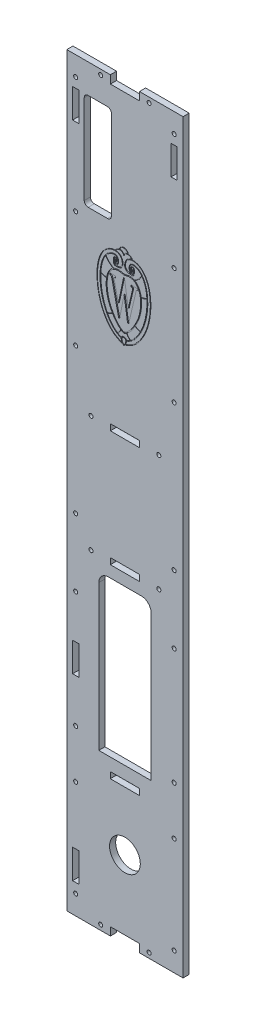
from build123d import *

# Parameters (mm, degrees)
SKETCH2_W               = 60
SKETCH2_H               = 385
BOSS_EXTRUDE1_DEPTH     = 3.175
CUT_EXTRUDE1_DEPTH      = 347.316445791
CUT_EXTRUDE1_DEPTH_BACK = 347.316445791
SKETCH4_R               = 7.9375
CUT_EXTRUDE2_DEPTH      = 347.316445791
CUT_EXTRUDE2_DEPTH_BACK = 347.316445791
SKETCH5_W               = 3.175
SKETCH5_H               = 15
SKETCH6_R               = 1.05
CUT_EXTRUDE3_DEPTH      = 3.175
SKETCH8_W               = 15
SKETCH8_H               = 4.175
CUT_EXTRUDE4_DEPTH      = 10
CUT_EXTRUDE5_DEPTH      = 10
SKETCH13_R              = 1.05
CUT_EXTRUDE8_DEPTH      = 347.316445791
SKETCH17_W              = 14
SKETCH17_H              = 50
CUT_EXTRUDE12_DEPTH     = 347.316445791
FILLET1_R               = 2
SKETCH18_R              = 1.05
CUT_EXTRUDE13_DEPTH     = 347.316445791
SKETCH19_R              = 1.05
CUT_EXTRUDE14_DEPTH     = 347.316445791
SKETCH20_W              = 15.1
SKETCH20_H              = 3.2
CUT_EXTRUDE15_DEPTH     = 347.316445791
CAVITY1_START           = -7.55
CAVITY1_OUTLINE_W       = 3.175
CAVITY1_OUTLINE_H       = 3.175
CAVITY1_DEPTH           = 15
SKETCH21_W              = 15.1
SKETCH21_H              = 3.2
CUT_EXTRUDE16_DEPTH     = 347.316445791
CAVITY2_START           = 2.675
CAVITY2_DEPTH           = 0.5


# Read off the part's stored shape, not the designer's step: Cavity1, Cavity2
with BuildPart() as part:
    # Sketch2 → Boss-Extrude1 (new body)
    with BuildSketch(Plane.XY):
        with Locations((0, 152.5)):
            Rectangle(SKETCH2_W, SKETCH2_H)
    extrude(amount=BOSS_EXTRUDE1_DEPTH)

    # Sketch4 → Cut-Extrude1 (cut, two sides: drawn at the far end of the back side and taken through both)
    with BuildSketch(Plane.XY.offset(3.175).offset(-CUT_EXTRUDE1_DEPTH_BACK)):
        Circle(SKETCH4_R)
    extrude(amount=CUT_EXTRUDE1_DEPTH + CUT_EXTRUDE1_DEPTH_BACK, mode=Mode.SUBTRACT)

    # Sketch5 → Cut-Extrude2 (cut, two sides: drawn at the far end of the back side and taken through both)
    with BuildSketch(Plane.XY.offset(3.175).offset(-CUT_EXTRUDE2_DEPTH_BACK)):
        with Locations((-25.4125, 322.5)):
            Rectangle(SKETCH5_W, SKETCH5_H)
        with Locations((-25.4125, 75)):
            Rectangle(SKETCH5_W, SKETCH5_H)
        with Locations((-25.4125, -17.5)):
            Rectangle(SKETCH5_W, SKETCH5_H)
        with Locations((25.4125, 322.5)):
            Rectangle(SKETCH5_W, SKETCH5_H)
    extrude(amount=CUT_EXTRUDE2_DEPTH + CUT_EXTRUDE2_DEPTH_BACK, mode=Mode.SUBTRACT)

    # Sketch6 → Cut-Extrude3 (cut)
    with BuildSketch(Plane.XY.offset(3.175)):
        with Locations((-25.4125, 335)):
            Circle(SKETCH6_R)
        with Locations((-25.4125, 105)):
            Circle(SKETCH6_R)
        with Locations((-25.4125, 45)):
            Circle(SKETCH6_R)
        with Locations((-25.4125, -30)):
            Circle(SKETCH6_R)
    cut_extrude3 = extrude(amount=-CUT_EXTRUDE3_DEPTH, mode=Mode.SUBTRACT)

    # Mirror2: Cut-Extrude3 across plane
    add(cut_extrude3.mirror(Plane(origin=(0, 0, 0), x_dir=(0, 0, 1), z_dir=(1, 0, 0))), mode=Mode.SUBTRACT)

    # Sketch8 → Cut-Extrude4 (cut)
    with BuildSketch(Plane.XY.offset(3.175)):
        with Locations((0, 342.9125)):
            Rectangle(SKETCH8_W, SKETCH8_H)
        with Locations((0, -37.9125)):
            Rectangle(SKETCH8_W, SKETCH8_H)
    extrude(amount=-CUT_EXTRUDE4_DEPTH, mode=Mode.SUBTRACT)

    # Sketch9 → Cut-Extrude5 (cut)
    with BuildSketch(Plane.XY.offset(3.175)):
        with BuildLine():
            Line((-13.5, 40), (13.5, 40))
            Line((13.5, 40), (13.5, 115))
            ThreePointArc((13.5, 115), (12.035533906, 118.535533906), (8.5, 120))
            Line((8.5, 120), (-8.5, 120))
            ThreePointArc((-8.5, 120), (-12.035533906, 118.535533906), (-13.5, 115))
            Line((-13.5, 115), (-13.5, 40))
        make_face()
    extrude(amount=-CUT_EXTRUDE5_DEPTH, mode=Mode.SUBTRACT)

    # Sketch13 → Cut-Extrude8 (cut, through all)
    with BuildSketch(Plane.XY.offset(3.175)):
        with Locations((-12.5, 342.4125)):
            Circle(SKETCH13_R)
        with Locations((-12.5, -37.4125)):
            Circle(SKETCH13_R)
    cut_extrude8 = extrude(amount=-CUT_EXTRUDE8_DEPTH, mode=Mode.SUBTRACT)

    # Mirror4: Cut-Extrude8 across plane
    add(cut_extrude8.mirror(Plane(origin=(0, 0, 0), x_dir=(0, 0, 1), z_dir=(1, 0, 0))), mode=Mode.SUBTRACT)

    # Sketch17 → Cut-Extrude12 (cut, through all)
    with BuildSketch(Plane.XY.offset(3.175)):
        with Locations((-14, 305)):
            Rectangle(SKETCH17_W, SKETCH17_H)
    extrude(amount=-CUT_EXTRUDE12_DEPTH, mode=Mode.SUBTRACT)

    # Fillet1
    fillet1_edges = [part.edges().sort_by_distance(p)[0] for p in [
        (-21, 280, 1.5875),
        (-21, 330, 1.5875),
        (-7, 330, 1.5875),
        (-7, 280, 1.5875),
    ]]
    fillet(fillet1_edges, radius=FILLET1_R)

    # Sketch18 → Cut-Extrude13 (cut, through all)
    with BuildSketch(Plane.XY.offset(3.175)):
        with Locations((-25.4, 275)):
            Circle(SKETCH18_R)
        with Locations((-25.4, 215)):
            Circle(SKETCH18_R)
        with Locations((-25.4, 140)):
            Circle(SKETCH18_R)
        with Locations((-25.4, 20)):
            Circle(SKETCH18_R)
    cut_extrude13 = extrude(amount=-CUT_EXTRUDE13_DEPTH, mode=Mode.SUBTRACT)

    # Mirror8: Cut-Extrude13 across plane
    add(cut_extrude13.mirror(Plane(origin=(0, 0, 0), x_dir=(0, 0, 1), z_dir=(1, 0, 0))), mode=Mode.SUBTRACT)

    # Sketch19 → Cut-Extrude14 (cut, through all)
    with BuildSketch(Plane.XY.offset(3.175)):
        with Locations((-17.5, 187.493166152)):
            Circle(SKETCH19_R)
        with Locations((-17.5, 127.493166152)):
            Circle(SKETCH19_R)
    cut_extrude14 = extrude(amount=-CUT_EXTRUDE14_DEPTH, mode=Mode.SUBTRACT)

    # Mirror9: Cut-Extrude14 across plane
    add(cut_extrude14.mirror(Plane(origin=(0, 0, 0), x_dir=(0, 0, 1), z_dir=(1, 0, 0))), mode=Mode.SUBTRACT)

    # Sketch20 → Cut-Extrude15 (cut, through all)
    with BuildSketch(Plane.XY.offset(3.175)):
        with Locations((0, 31.9)):
            Rectangle(SKETCH20_W, SKETCH20_H)
    extrude(amount=-CUT_EXTRUDE15_DEPTH, mode=Mode.SUBTRACT)

    # Cavity1 outline → Cavity1 (cut)
    with BuildSketch(Plane.YZ.offset(CAVITY1_START)):
        with Locations((127.5625, 1.5875)):
            Rectangle(CAVITY1_OUTLINE_W, CAVITY1_OUTLINE_H)
    extrude(amount=CAVITY1_DEPTH, mode=Mode.SUBTRACT)

    # Sketch21 → Cut-Extrude16 (cut, through all)
    with BuildSketch(Plane.XY.offset(3.175)):
        with Locations((0, 187.4)):
            Rectangle(SKETCH21_W, SKETCH21_H)
    extrude(amount=-CUT_EXTRUDE16_DEPTH, mode=Mode.SUBTRACT)

    # Cavity2 outline → Cavity2 (cut)
    # profile 1 of 2: a face of its own
    with BuildSketch(Plane.XY.offset(CAVITY2_START)):
        with BuildLine():
            Line((-1.094866392, 227.97508428), (-1.063616016, 227.928208715))
            add(Edge.make_bspline(
                [(-1.063616016, 227.928208715), (-0.85423849, 227.614142426), (-0.612048069, 227.362889396), (-0.52923457, 227.340389124)],
                knots=[0, 0, 0, 0, 1, 1, 1, 1], degree=3))
            add(Edge.make_bspline(
                [(-0.52923457, 227.340389124), (-0.446733575, 227.362576892), (-0.204855657, 227.614142426), (0.004521868, 227.928208715)],
                knots=[0, 0, 0, 0, 1, 1, 1, 1], degree=3))
            Line((0.004521868, 227.928208715), (0.035772245, 227.97508428))
            Line((0.035772245, 227.97508428), (0.091085412, 227.987896934))
            add(Edge.make_bspline(
                [(0.091085412, 227.987896934), (9.266820775, 230.126985236), (14.378132426, 244.212467006), (13.226556036, 255.516040534)],
                knots=[0, 0, 0, 0, 1, 1, 1, 1], degree=3))
            add(Edge.make_bspline(
                [(13.226556036, 255.516040534), (13.09342943, 256.821368778), (12.874989296, 258.050133599), (12.576235692, 259.188272327)],
                knots=[0, 0, 0, 0, 1, 1, 1, 1], degree=3))
            add(Edge.make_bspline(
                [(12.576235692, 259.188272327), (12.269669494, 260.352973876), (11.873727219, 261.441424504), (11.399033993, 262.423623851)],
                knots=[0, 0, 0, 0, 1, 1, 1, 1], degree=3))
            add(Edge.make_bspline(
                [(11.399033993, 262.423623851), (10.868715096, 263.520199578), (10.229332384, 264.482398684), (9.498073564, 265.283033341)],
                knots=[0, 0, 0, 0, 1, 1, 1, 1], degree=3))
            add(Edge.make_bspline(
                [(9.498073564, 265.283033341), (7.973992681, 266.953053484), (6.089907456, 267.851189005), (4.049258155, 267.880251855)],
                knots=[0, 0, 0, 0, 1, 1, 1, 1], degree=3))
            add(Edge.make_bspline(
                [(4.049258155, 267.880251855), (4.002695093, 267.881189367), (3.870193495, 267.884939412), (3.858630855, 268.007753393)],
                knots=[0, 0, 0, 0, 1, 1, 1, 1], degree=3))
            add(Edge.make_bspline(
                [(3.858630855, 268.007753393), (3.501439047, 268.735262168), (2.582365461, 269.243705801), (1.896107184, 269.33901945)],
                knots=[0, 0, 0, 0, 1, 1, 1, 1], degree=3))
            Line((1.896107184, 269.33901945), (1.80048103, 269.352457113))
            Line((1.80048103, 269.352457113), (1.777043248, 269.446520747))
            add(Edge.make_bspline(
                [(1.777043248, 269.446520747), (1.757980518, 269.523084171), (1.321100248, 271.245292443), (-0.531109593, 271.245292443)],
                knots=[0, 0, 0, 0, 1, 1, 1, 1], degree=3))
            add(Edge.make_bspline(
                [(-0.531109593, 271.245292443), (-2.388319494, 271.245292443), (-2.83488738, 269.473708575), (-2.839574937, 269.454958349)],
                knots=[0, 0, 0, 0, 1, 1, 1, 1], degree=3))
            Line((-2.839574937, 269.454958349), (-2.862387712, 269.360582211))
            Line((-2.862387712, 269.360582211), (-2.958638873, 269.347144548))
            add(Edge.make_bspline(
                [(-2.958638873, 269.347144548), (-3.645834662, 269.250893388), (-4.559595683, 268.736199679), (-4.91835001, 268.010565927)],
                knots=[0, 0, 0, 0, 1, 1, 1, 1], degree=3))
            add(Edge.make_bspline(
                [(-4.91835001, 268.010565927), (-4.928037627, 267.885251916), (-5.061476737, 267.881189367), (-5.106477279, 267.880251855)],
                knots=[0, 0, 0, 0, 1, 1, 1, 1], degree=3))
            add(Edge.make_bspline(
                [(-5.106477279, 267.880251855), (-7.149001603, 267.851189005), (-9.033399332, 266.953053484), (-10.557167712, 265.283033341)],
                knots=[0, 0, 0, 0, 1, 1, 1, 1], degree=3))
            add(Edge.make_bspline(
                [(-10.557167712, 265.283033341), (-11.395302821, 264.374584883), (-12.117811536, 263.232071103), (-12.70594363, 261.886429872)],
                knots=[0, 0, 0, 0, 1, 1, 1, 1], degree=3))
            Line((-12.70594363, 261.886429872), (-12.824382558, 261.606738998))
            add(Edge.make_bspline(
                [(-12.824382558, 261.606738998), (-13.562828965, 259.833905115), (-14.054709898, 257.784505396), (-14.285650184, 255.516040534)],
                knots=[0, 0, 0, 0, 1, 1, 1, 1], degree=3))
            add(Edge.make_bspline(
                [(-14.285650184, 255.516040534), (-15.436601566, 244.212154502), (-10.324977411, 230.126985236), (-1.15017956, 227.987896934)],
                knots=[0, 0, 0, 0, 1, 1, 1, 1], degree=3))
            Line((-1.15017956, 227.987896934), (-1.094866392, 227.97508428))
        make_face()
        with BuildLine():
            add(Edge.make_bspline(
                [(-0.529328321, 230.969838839), (-0.843394609, 230.966401298), (-1.389651198, 230.81983703), (-1.452464456, 230.495145614)],
                knots=[0, 0, 0, 0, 1, 1, 1, 1], degree=3))
            add(Edge.make_bspline(
                [(0.393807814, 230.495145614), (0.330682052, 230.81983703), (-0.215262033, 230.966401298), (-0.529328321, 230.969838839)],
                knots=[0, 0, 0, 0, 1, 1, 1, 1], degree=3))
            add(Edge.make_bspline(
                [(-0.371201414, 227.877301851), (0.025053366, 228.375432859), (0.616623001, 229.341694514), (0.393807814, 230.495145614)],
                knots=[0, 0, 0, 0, 1, 1, 1, 1], degree=3))
            add(Edge.make_bspline(
                [(-0.529328321, 227.771050569), (-0.451514883, 227.780113178), (-0.377451489, 227.870114264), (-0.371201414, 227.877301851)],
                knots=[0, 0, 0, 0, 1, 1, 1, 1], degree=3))
            add(Edge.make_bspline(
                [(-0.687455228, 227.877301851), (-0.681205153, 227.870114264), (-0.607454263, 227.780113178), (-0.529328321, 227.771050569)],
                knots=[0, 0, 0, 0, 1, 1, 1, 1], degree=3))
            add(Edge.make_bspline(
                [(-1.452464456, 230.495145614), (-1.675279643, 229.341694514), (-1.084022512, 228.375432859), (-0.687455228, 227.877301851)],
                knots=[0, 0, 0, 0, 1, 1, 1, 1], degree=3))
        make_face(mode=Mode.SUBTRACT)
        with BuildLine():
            add(Edge.make_bspline(
                [(0.801000225, 230.505145734), (1.429132801, 230.734836005), (2.03257758, 231.03952718), (2.61289708, 231.407031613)],
                knots=[0, 0, 0, 0, 1, 1, 1, 1], degree=3))
            add(Edge.make_bspline(
                [(0.791625112, 230.572021541), (0.795375157, 230.54952127), (0.79725018, 230.527333502), (0.801000225, 230.505145734)],
                knots=[0, 0, 0, 0, 1, 1, 1, 1], degree=3))
            add(Edge.make_bspline(
                [(-0.529328321, 231.377656258), (-0.210574476, 231.376718747), (0.661936048, 231.239842096), (0.791625112, 230.572021541)],
                knots=[0, 0, 0, 0, 1, 1, 1, 1], degree=3))
            add(Edge.make_bspline(
                [(-1.850594258, 230.572021541), (-1.720905194, 231.239842096), (-0.84839467, 231.376718747), (-0.529328321, 231.377656258)],
                knots=[0, 0, 0, 0, 1, 1, 1, 1], degree=3))
            add(Edge.make_bspline(
                [(-1.859969371, 230.505145734), (-1.855906822, 230.527333502), (-1.854344303, 230.54952127), (-1.850594258, 230.572021541)],
                knots=[0, 0, 0, 0, 1, 1, 1, 1], degree=3))
            add(Edge.make_bspline(
                [(-3.671553722, 231.407031613), (-3.091546726, 231.03952718), (-2.488101947, 230.734836005), (-1.859969371, 230.505145734)],
                knots=[0, 0, 0, 0, 1, 1, 1, 1], degree=3))
            add(Edge.make_bspline(
                [(-1.882782146, 233.605808134), (-2.326224995, 232.553607942), (-3.250923648, 231.738910616), (-3.671553722, 231.407031613)],
                knots=[0, 0, 0, 0, 1, 1, 1, 1], degree=3))
            add(Edge.make_bspline(
                [(-0.529328321, 232.860799148), (-0.613079331, 232.887674472), (-1.25464957, 233.147990112), (-1.882782146, 233.605808134)],
                knots=[0, 0, 0, 0, 1, 1, 1, 1], degree=3))
            add(Edge.make_bspline(
                [(0.824125504, 233.605808134), (0.195680424, 233.147990112), (-0.445889815, 232.887674472), (-0.529328321, 232.860799148)],
                knots=[0, 0, 0, 0, 1, 1, 1, 1], degree=3))
            add(Edge.make_bspline(
                [(2.61289708, 231.407031613), (2.191954502, 231.738910616), (1.267255849, 232.553607942), (0.824125504, 233.605808134)],
                knots=[0, 0, 0, 0, 1, 1, 1, 1], degree=3))
        make_face(mode=Mode.SUBTRACT)
        with BuildLine():
            add(Edge.make_bspline(
                [(-9.008492782, 237.706170091), (-7.657226483, 235.093951083), (-5.939393576, 232.929862481), (-3.90936909, 231.56515852)],
                knots=[0, 0, 0, 0, 1, 1, 1, 1], degree=3))
            add(Edge.make_bspline(
                [(-6.395024072, 238.900872001), (-7.268784298, 238.131175217), (-8.488799014, 237.812733876), (-9.008492782, 237.706170091)],
                knots=[0, 0, 0, 0, 1, 1, 1, 1], degree=3))
            add(Edge.make_bspline(
                [(-2.118097484, 233.769872613), (-3.295299183, 234.615507812), (-4.838442796, 236.216777126), (-6.395024072, 238.900872001)],
                knots=[0, 0, 0, 0, 1, 1, 1, 1], degree=3))
            add(Edge.make_bspline(
                [(-3.90936909, 231.56515852), (-3.554364808, 231.839536829), (-2.544352626, 232.688609571), (-2.118097484, 233.769872613)],
                knots=[0, 0, 0, 0, 1, 1, 1, 1], degree=3))
        make_face(mode=Mode.SUBTRACT)
        with BuildLine():
            add(Edge.make_bspline(
                [(-12.412596341, 254.066679615), (-12.677599538, 248.64005166), (-11.483522635, 242.620604368), (-9.137869342, 237.95648561)],
                knots=[0, 0, 0, 0, 1, 1, 1, 1], degree=3))
            add(Edge.make_bspline(
                [(-9.501936234, 253.252294792), (-10.833827299, 253.369483705), (-11.861339692, 253.789176267), (-12.412596341, 254.066679615)],
                knots=[0, 0, 0, 0, 1, 1, 1, 1], degree=3))
            add(Edge.make_bspline(
                [(-9.662875675, 251.577899596), (-9.64756299, 251.94884157), (-9.605999989, 252.54416125), (-9.501936234, 253.252294792)],
                knots=[0, 0, 0, 0, 1, 1, 1, 1], degree=3))
            add(Edge.make_bspline(
                [(-9.466935812, 247.566601212), (-9.651938043, 248.896617255), (-9.718188842, 250.243508501), (-9.662875675, 251.577899596)],
                knots=[0, 0, 0, 0, 1, 1, 1, 1], degree=3))
            add(Edge.make_bspline(
                [(-8.62692568, 243.859681501), (-9.010992812, 245.064071028), (-9.291933701, 246.30783603), (-9.466935812, 247.566601212)],
                knots=[0, 0, 0, 0, 1, 1, 1, 1], degree=3))
            add(Edge.make_bspline(
                [(-6.534088249, 239.1411874), (-7.383160678, 240.640580485), (-8.102856858, 242.216849498), (-8.62692568, 243.859681501)],
                knots=[0, 0, 0, 0, 1, 1, 1, 1], degree=3))
            add(Edge.make_bspline(
                [(-9.137869342, 237.95648561), (-8.700051562, 238.042424147), (-7.400660889, 238.353052894), (-6.534088249, 239.1411874)],
                knots=[0, 0, 0, 0, 1, 1, 1, 1], degree=3))
        make_face(mode=Mode.SUBTRACT)
        with BuildLine():
            add(Edge.make_bspline(
                [(-13.703861916, 257.600159422), (-13.880426546, 256.634210271), (-13.997615459, 255.658573503), (-14.078553936, 254.680437018)],
                knots=[0, 0, 0, 0, 1, 1, 1, 1], degree=3))
            add(Edge.make_bspline(
                [(-12.981040698, 260.438318655), (-13.296044497, 259.513620002), (-13.528547302, 258.560483505), (-13.703861916, 257.600159422)],
                knots=[0, 0, 0, 0, 1, 1, 1, 1], degree=3))
            add(Edge.make_bspline(
                [(-11.916965363, 262.900848357), (-12.346033038, 262.113963866), (-12.692599719, 261.286141381), (-12.981040698, 260.438318655)],
                knots=[0, 0, 0, 0, 1, 1, 1, 1], degree=3))
            add(Edge.make_bspline(
                [(-10.32319614, 265.14618794), (-10.95664128, 264.481179919), (-11.478522575, 263.705545564), (-11.916965363, 262.900848357)],
                knots=[0, 0, 0, 0, 1, 1, 1, 1], degree=3))
            add(Edge.make_bspline(
                [(-8.315984429, 266.717456892), (-9.069743521, 266.306826939), (-9.732876519, 265.766507922), (-10.32319614, 265.14618794)],
                knots=[0, 0, 0, 0, 1, 1, 1, 1], degree=3))
            add(Edge.make_bspline(
                [(-7.338160135, 267.158087207), (-7.674726694, 267.036523241), (-8.001605637, 266.888708958), (-8.315984429, 266.717456892)],
                knots=[0, 0, 0, 0, 1, 1, 1, 1], degree=3))
            add(Edge.make_bspline(
                [(-6.818154175, 267.322151686), (-6.993781294, 267.274651113), (-7.167220573, 267.21965045), (-7.338160135, 267.158087207)],
                knots=[0, 0, 0, 0, 1, 1, 1, 1], degree=3))
            add(Edge.make_bspline(
                [(-6.295647873, 267.452778262), (-6.468462457, 267.428715471), (-6.658777253, 267.36558971), (-6.818154175, 267.322151686)],
                knots=[0, 0, 0, 0, 1, 1, 1, 1], degree=3))
            add(Edge.make_bspline(
                [(-4.999694741, 267.559029543), (-5.434074981, 267.559029543), (-5.86845522, 267.532154219), (-6.295647873, 267.452778262)],
                knots=[0, 0, 0, 0, 1, 1, 1, 1], degree=3))
            add(Edge.make_bspline(
                [(-3.033733529, 267.02902315), (-3.788117628, 267.503091369), (-4.645627971, 267.559029543), (-4.999694741, 267.559029543)],
                knots=[0, 0, 0, 0, 1, 1, 1, 1], degree=3))
            add(Edge.make_bspline(
                [(-1.345275663, 263.968361234), (-1.47433972, 265.458066702), (-2.202473502, 266.438078523), (-3.033733529, 267.02902315)],
                knots=[0, 0, 0, 0, 1, 1, 1, 1], degree=3))
            add(Edge.make_bspline(
                [(-3.932494369, 261.325204353), (-3.475613858, 261.321141804), (-1.14527325, 261.682083657), (-1.345275663, 263.968361234)],
                knots=[0, 0, 0, 0, 1, 1, 1, 1], degree=3))
            add(Edge.make_bspline(
                [(-3.812492922, 261.626145482), (-4.039058155, 261.391767655), (-4.002495214, 261.326141864), (-3.932494369, 261.325204353)],
                knots=[0, 0, 0, 0, 1, 1, 1, 1], degree=3))
            add(Edge.make_bspline(
                [(-3.281549018, 264.209614143), (-3.102171854, 263.365228959), (-3.276861461, 262.313341271), (-3.812492922, 261.626145482)],
                knots=[0, 0, 0, 0, 1, 1, 1, 1], degree=3))
            add(Edge.make_bspline(
                [(-5.316573564, 266.076824165), (-4.242810612, 266.078699188), (-3.502489183, 265.259001801), (-3.281549018, 264.209614143)],
                knots=[0, 0, 0, 0, 1, 1, 1, 1], degree=3))
            add(Edge.make_bspline(
                [(-9.425997818, 264.105237885), (-8.358484942, 265.268689418), (-6.923467945, 266.074011631), (-5.316573564, 266.076824165)],
                knots=[0, 0, 0, 0, 1, 1, 1, 1], degree=3))
            add(Edge.make_bspline(
                [(-11.687587596, 260.122377344), (-11.178518956, 261.56208221), (-10.464760347, 262.972724224), (-9.425997818, 264.105237885)],
                knots=[0, 0, 0, 0, 1, 1, 1, 1], degree=3))
            add(Edge.make_bspline(
                [(-12.801976038, 254.362933188), (-12.670411951, 256.31826896), (-12.342282993, 258.270792511), (-11.687587596, 260.122377344)],
                knots=[0, 0, 0, 0, 1, 1, 1, 1], degree=3))
            add(Edge.make_bspline(
                [(-12.68603714, 248.975680708), (-12.871976882, 250.763202269), (-12.922602493, 252.568849048), (-12.801976038, 254.362933188)],
                knots=[0, 0, 0, 0, 1, 1, 1, 1], degree=3))
            add(Edge.make_bspline(
                [(-11.699150236, 243.611866012), (-12.168218394, 245.370012218), (-12.49790987, 247.16597138), (-12.68603714, 248.975680708)],
                knots=[0, 0, 0, 0, 1, 1, 1, 1], degree=3))
            add(Edge.make_bspline(
                [(-9.913503698, 238.62305615), (-10.656012654, 240.22807551), (-11.24351974, 241.903720721), (-11.699150236, 243.611866012)],
                knots=[0, 0, 0, 0, 1, 1, 1, 1], degree=3))
            add(Edge.make_bspline(
                [(-7.139095234, 234.055501058), (-8.260046254, 235.447080343), (-9.167869704, 237.010536701), (-9.913503698, 238.62305615)],
                knots=[0, 0, 0, 0, 1, 1, 1, 1], degree=3))
            add(Edge.make_bspline(
                [(-3.020920874, 230.575771586), (-4.624377714, 231.398594011), (-6.013769473, 232.658296705), (-7.139095234, 234.055501058)],
                knots=[0, 0, 0, 0, 1, 1, 1, 1], degree=3))
            add(Edge.make_bspline(
                [(-1.903094891, 230.090766049), (-2.286224512, 230.227017692), (-2.659354013, 230.390144347), (-3.020920874, 230.575771586)],
                knots=[0, 0, 0, 0, 1, 1, 1, 1], degree=3))
            add(Edge.make_bspline(
                [(-1.566528332, 228.520747112), (-1.772780819, 228.961377426), (-1.925282659, 229.493571346), (-1.903094891, 230.090766049)],
                knots=[0, 0, 0, 0, 1, 1, 1, 1], degree=3))
            add(Edge.make_bspline(
                [(-2.039346535, 228.660123793), (-1.826531468, 228.590122948), (-1.820281392, 228.577622798), (-1.566528332, 228.520747112)],
                knots=[0, 0, 0, 0, 1, 1, 1, 1], degree=3))
            add(Edge.make_bspline(
                [(-5.01031987, 230.143579186), (-4.092183795, 229.513259083), (-3.090296711, 229.006690473), (-2.039346535, 228.660123793)],
                knots=[0, 0, 0, 0, 1, 1, 1, 1], degree=3))
            add(Edge.make_bspline(
                [(-6.653777193, 231.469219863), (-6.143458537, 230.990464088), (-5.593451903, 230.543583698), (-5.01031987, 230.143579186)],
                knots=[0, 0, 0, 0, 1, 1, 1, 1], degree=3))
            add(Edge.make_bspline(
                [(-7.844728745, 232.718922436), (-7.470661733, 232.281417159), (-7.073469442, 231.863287116), (-6.653777193, 231.469219863)],
                knots=[0, 0, 0, 0, 1, 1, 1, 1], degree=3))
            add(Edge.make_bspline(
                [(-8.581925137, 233.636433503), (-8.34504728, 233.32361723), (-8.099731821, 233.017051032), (-7.844728745, 232.718922436)],
                knots=[0, 0, 0, 0, 1, 1, 1, 1], degree=3))
            add(Edge.make_bspline(
                [(-11.404146678, 238.539930148), (-10.65320012, 236.815534349), (-9.718188842, 235.137389107), (-8.581925137, 233.636433503)],
                knots=[0, 0, 0, 0, 1, 1, 1, 1], degree=3))
            add(Edge.make_bspline(
                [(-13.13791759, 243.702804608), (-12.702287336, 241.938721143), (-12.12978043, 240.206200246), (-11.404146678, 238.539930148)],
                knots=[0, 0, 0, 0, 1, 1, 1, 1], degree=3))
            add(Edge.make_bspline(
                [(-14.044178521, 249.194120843), (-13.885114102, 247.344098529), (-13.582922958, 245.505638854), (-13.13791759, 243.702804608)],
                knots=[0, 0, 0, 0, 1, 1, 1, 1], degree=3))
            add(Edge.make_bspline(
                [(-14.078553936, 254.680437018), (-14.22980576, 252.858227539), (-14.200742909, 251.014767803), (-14.044178521, 249.194120843)],
                knots=[0, 0, 0, 0, 1, 1, 1, 1], degree=3))
        make_face(mode=Mode.SUBTRACT)
        with BuildLine():
            add(Edge.make_bspline(
                [(-0.717111836, 233.504869416), (-3.048389955, 234.540506908), (-5.410918452, 237.58585614), (-7.366566728, 241.8937206)],
                knots=[0, 0, 0, 0, 1, 1, 1, 1], degree=3))
            add(Edge.make_bspline(
                [(-7.366566728, 241.8937206), (-7.838759923, 242.931232802), (-9.360965783, 246.691278155), (-9.159088348, 251.505398721)],
                knots=[0, 0, 0, 0, 1, 1, 1, 1], degree=3))
            add(Edge.make_bspline(
                [(-9.159088348, 251.505398721), (-9.101900159, 252.866352637), (-8.704395364, 257.021402441), (-5.876861572, 258.824236687)],
                knots=[0, 0, 0, 0, 1, 1, 1, 1], degree=3))
            add(Edge.make_bspline(
                [(-5.876861572, 258.824236687), (-5.265604199, 259.212991376), (-4.463094519, 259.384555945), (-3.65652229, 259.437056578)],
                knots=[0, 0, 0, 0, 1, 1, 1, 1], degree=3))
            add(Edge.make_bspline(
                [(-3.65652229, 259.437056578), (-2.268380547, 259.527370168), (-1.239618138, 258.996738767), (-0.546797282, 258.977363533)],
                knots=[0, 0, 0, 0, 1, 1, 1, 1], degree=3))
            Line((-0.546797282, 258.977363533), (-0.512109363, 258.977363533))
            add(Edge.make_bspline(
                [(-0.512109363, 258.977363533), (0.180711493, 258.996738767), (1.217599, 259.527370168), (2.605740743, 259.437056578)],
                knots=[0, 0, 0, 0, 1, 1, 1, 1], degree=3))
            add(Edge.make_bspline(
                [(2.605740743, 259.437056578), (3.411687964, 259.384555945), (4.206697554, 259.212991376), (4.817954926, 258.824236687)],
                knots=[0, 0, 0, 0, 1, 1, 1, 1], degree=3))
            add(Edge.make_bspline(
                [(4.817954926, 258.824236687), (7.644863711, 257.021402441), (8.042993513, 252.866352637), (8.100181703, 251.505398721)],
                knots=[0, 0, 0, 0, 1, 1, 1, 1], degree=3))
            add(Edge.make_bspline(
                [(8.100181703, 251.505398721), (8.302059138, 246.691278155), (6.780165782, 242.931232802), (6.30828509, 241.8937206)],
                knots=[0, 0, 0, 0, 1, 1, 1, 1], degree=3))
            add(Edge.make_bspline(
                [(6.30828509, 241.8937206), (4.351386799, 237.58585614), (1.989795814, 234.540506908), (-0.34273232, 233.504869416)],
                knots=[0, 0, 0, 0, 1, 1, 1, 1], degree=3))
            Line((-0.34273232, 233.504869416), (-0.528984567, 233.42143091))
            Line((-0.528984567, 233.42143091), (-0.717111836, 233.504869416))
        make_face(mode=Mode.SUBTRACT)
        with BuildLine():
            add(Edge.make_bspline(
                [(2.850399944, 231.56515852), (4.88042443, 232.929862481), (6.598257337, 235.093951083), (7.949523636, 237.706170091)],
                knots=[0, 0, 0, 0, 1, 1, 1, 1], degree=3))
            add(Edge.make_bspline(
                [(1.059128338, 233.769872613), (1.485695984, 232.688609571), (2.495708166, 231.839536829), (2.850399944, 231.56515852)],
                knots=[0, 0, 0, 0, 1, 1, 1, 1], degree=3))
            add(Edge.make_bspline(
                [(5.336367429, 238.900872001), (3.77947365, 236.216777126), (2.236330038, 234.615507812), (1.059128338, 233.769872613)],
                knots=[0, 0, 0, 0, 1, 1, 1, 1], degree=3))
            add(Edge.make_bspline(
                [(7.949523636, 237.706170091), (7.429829868, 237.812733876), (6.209815152, 238.131175217), (5.336367429, 238.900872001)],
                knots=[0, 0, 0, 0, 1, 1, 1, 1], degree=3))
        make_face(mode=Mode.SUBTRACT)
        with BuildLine():
            add(Edge.make_bspline(
                [(0.844438249, 230.090766049), (0.866626017, 229.493571346), (0.713811673, 228.961377426), (0.507559186, 228.520747112)],
                knots=[0, 0, 0, 0, 1, 1, 1, 1], degree=3))
            add(Edge.make_bspline(
                [(1.961951728, 230.575771586), (1.600384867, 230.390144347), (1.227255366, 230.227017692), (0.844438249, 230.090766049)],
                knots=[0, 0, 0, 0, 1, 1, 1, 1], degree=3))
            add(Edge.make_bspline(
                [(6.080126088, 234.055501058), (4.954800327, 232.658296705), (3.565721072, 231.398594011), (1.961951728, 230.575771586)],
                knots=[0, 0, 0, 0, 1, 1, 1, 1], degree=3))
            add(Edge.make_bspline(
                [(8.854847056, 238.62305615), (8.109213062, 237.010536701), (7.201077108, 235.447080343), (6.080126088, 234.055501058)],
                knots=[0, 0, 0, 0, 1, 1, 1, 1], degree=3))
            add(Edge.make_bspline(
                [(10.640493594, 243.611866012), (10.184863098, 241.903720721), (9.597043508, 240.22807551), (8.854847056, 238.62305615)],
                knots=[0, 0, 0, 0, 1, 1, 1, 1], degree=3))
            add(Edge.make_bspline(
                [(11.627380497, 248.975680708), (11.438940724, 247.16597138), (11.109561752, 245.370012218), (10.640493594, 243.611866012)],
                knots=[0, 0, 0, 0, 1, 1, 1, 1], degree=3))
            add(Edge.make_bspline(
                [(11.743006892, 254.362933188), (11.863945851, 252.568849048), (11.81332024, 250.763202269), (11.627380497, 248.975680708)],
                knots=[0, 0, 0, 0, 1, 1, 1, 1], degree=3))
            add(Edge.make_bspline(
                [(10.628618451, 260.122377344), (11.283313847, 258.270792511), (11.611442805, 256.31826896), (11.743006892, 254.362933188)],
                knots=[0, 0, 0, 0, 1, 1, 1, 1], degree=3))
            add(Edge.make_bspline(
                [(8.367028672, 264.105237885), (9.405791201, 262.972724224), (10.11954981, 261.56208221), (10.628618451, 260.122377344)],
                knots=[0, 0, 0, 0, 1, 1, 1, 1], degree=3))
            add(Edge.make_bspline(
                [(4.257916921, 266.076824165), (5.864498487, 266.074011631), (7.299515796, 265.268689418), (8.367028672, 264.105237885)],
                knots=[0, 0, 0, 0, 1, 1, 1, 1], degree=3))
            add(Edge.make_bspline(
                [(2.222892375, 264.209614143), (2.44383254, 265.259001801), (3.18415397, 266.078699188), (4.257916921, 266.076824165)],
                knots=[0, 0, 0, 0, 1, 1, 1, 1], degree=3))
            add(Edge.make_bspline(
                [(2.753523776, 261.626145482), (2.217892315, 262.313341271), (2.043202708, 263.365228959), (2.222892375, 264.209614143)],
                knots=[0, 0, 0, 0, 1, 1, 1, 1], degree=3))
            add(Edge.make_bspline(
                [(2.873525223, 261.325204353), (2.943526068, 261.326141864), (2.980089009, 261.391767655), (2.753523776, 261.626145482)],
                knots=[0, 0, 0, 0, 1, 1, 1, 1], degree=3))
            add(Edge.make_bspline(
                [(0.286306517, 263.968361234), (0.086616608, 261.682083657), (2.416957216, 261.321141804), (2.873525223, 261.325204353)],
                knots=[0, 0, 0, 0, 1, 1, 1, 1], degree=3))
            add(Edge.make_bspline(
                [(1.975076886, 267.02902315), (1.143504356, 266.438078523), (0.415683077, 265.458066702), (0.286306517, 263.968361234)],
                knots=[0, 0, 0, 0, 1, 1, 1, 1], degree=3))
            add(Edge.make_bspline(
                [(3.940725595, 267.559029543), (3.586971329, 267.559029543), (2.729148482, 267.503091369), (1.975076886, 267.02902315)],
                knots=[0, 0, 0, 0, 1, 1, 1, 1], degree=3))
            add(Edge.make_bspline(
                [(5.236991231, 267.452778262), (4.809798578, 267.532154219), (4.375105835, 267.559029543), (3.940725595, 267.559029543)],
                knots=[0, 0, 0, 0, 1, 1, 1, 1], degree=3))
            add(Edge.make_bspline(
                [(5.75949722, 267.322151686), (5.599807794, 267.36558971), (5.399493191, 267.431215502), (5.236991231, 267.452778262)],
                knots=[0, 0, 0, 0, 1, 1, 1, 1], degree=3))
            add(Edge.make_bspline(
                [(6.279190989, 267.158087207), (6.108251427, 267.21965045), (5.934811835, 267.274651113), (5.75949722, 267.322151686)],
                knots=[0, 0, 0, 0, 1, 1, 1, 1], degree=3))
            add(Edge.make_bspline(
                [(7.257015283, 266.717456892), (6.942948995, 266.888708958), (6.616070052, 267.036523241), (6.279190989, 267.158087207)],
                knots=[0, 0, 0, 0, 1, 1, 1, 1], degree=3))
            add(Edge.make_bspline(
                [(9.264539497, 265.14618794), (8.673907373, 265.766507922), (8.011086879, 266.306826939), (7.257015283, 266.717456892)],
                knots=[0, 0, 0, 0, 1, 1, 1, 1], degree=3))
            add(Edge.make_bspline(
                [(10.857996217, 262.900848357), (10.419553429, 263.705545564), (9.897672134, 264.481179919), (9.264539497, 265.14618794)],
                knots=[0, 0, 0, 0, 1, 1, 1, 1], degree=3))
            add(Edge.make_bspline(
                [(11.922384056, 260.438318655), (11.633630573, 261.286141381), (11.287063893, 262.113963866), (10.857996217, 262.900848357)],
                knots=[0, 0, 0, 0, 1, 1, 1, 1], degree=3))
            add(Edge.make_bspline(
                [(12.645205274, 257.600159422), (12.469578156, 258.560483505), (12.237075351, 259.513620002), (11.922384056, 260.438318655)],
                knots=[0, 0, 0, 0, 1, 1, 1, 1], degree=3))
            add(Edge.make_bspline(
                [(13.019897293, 254.680437018), (12.938958817, 255.658573503), (12.8214574, 256.634210271), (12.645205274, 257.600159422)],
                knots=[0, 0, 0, 0, 1, 1, 1, 1], degree=3))
            add(Edge.make_bspline(
                [(12.985209375, 249.194120843), (13.141773764, 251.014767803), (13.170836614, 252.858227539), (13.019897293, 254.680437018)],
                knots=[0, 0, 0, 0, 1, 1, 1, 1], degree=3))
            add(Edge.make_bspline(
                [(12.078948444, 243.702804608), (12.523953812, 245.505638854), (12.82645746, 247.344098529), (12.985209375, 249.194120843)],
                knots=[0, 0, 0, 0, 1, 1, 1, 1], degree=3))
            add(Edge.make_bspline(
                [(10.345490035, 238.539930148), (11.071123788, 240.206200246), (11.643630693, 241.938721143), (12.078948444, 243.702804608)],
                knots=[0, 0, 0, 0, 1, 1, 1, 1], degree=3))
            add(Edge.make_bspline(
                [(7.522955991, 233.636433503), (8.659219696, 235.137389107), (9.594543478, 236.815534349), (10.345490035, 238.539930148)],
                knots=[0, 0, 0, 0, 1, 1, 1, 1], degree=3))
            add(Edge.make_bspline(
                [(6.785759599, 232.718922436), (7.040762675, 233.017051032), (7.286078134, 233.32361723), (7.522955991, 233.636433503)],
                knots=[0, 0, 0, 0, 1, 1, 1, 1], degree=3))
            add(Edge.make_bspline(
                [(5.594807734, 231.469219863), (6.0148128, 231.863287116), (6.411692587, 232.281417159), (6.785759599, 232.718922436)],
                knots=[0, 0, 0, 0, 1, 1, 1, 1], degree=3))
            add(Edge.make_bspline(
                [(3.951350724, 230.143579186), (4.534482757, 230.543583698), (5.084801895, 230.990464088), (5.594807734, 231.469219863)],
                knots=[0, 0, 0, 0, 1, 1, 1, 1], degree=3))
            add(Edge.make_bspline(
                [(0.980377389, 228.660123793), (2.031327565, 229.006690473), (3.033527153, 229.513259083), (3.951350724, 230.143579186)],
                knots=[0, 0, 0, 0, 1, 1, 1, 1], degree=3))
            add(Edge.make_bspline(
                [(0.507559186, 228.520747112), (0.761312246, 228.577622798), (0.767562322, 228.590122948), (0.980377389, 228.660123793)],
                knots=[0, 0, 0, 0, 1, 1, 1, 1], degree=3))
        make_face(mode=Mode.SUBTRACT)
        with BuildLine():
            add(Edge.make_bspline(
                [(8.0792127, 237.95648561), (10.424553489, 242.620604368), (11.618630392, 248.64005166), (11.353939699, 254.066679615)],
                knots=[0, 0, 0, 0, 1, 1, 1, 1], degree=3))
            add(Edge.make_bspline(
                [(5.47511879, 239.1411874), (6.342004247, 238.353052894), (7.641082416, 238.042424147), (8.0792127, 237.95648561)],
                knots=[0, 0, 0, 0, 1, 1, 1, 1], degree=3))
            add(Edge.make_bspline(
                [(7.567956534, 243.859681501), (7.043887712, 242.216849498), (6.324504035, 240.640580485), (5.47511879, 239.1411874)],
                knots=[0, 0, 0, 0, 1, 1, 1, 1], degree=3))
            add(Edge.make_bspline(
                [(8.408279169, 247.566601212), (8.233277059, 246.30783603), (7.95233617, 245.064071028), (7.567956534, 243.859681501)],
                knots=[0, 0, 0, 0, 1, 1, 1, 1], degree=3))
            add(Edge.make_bspline(
                [(8.604219033, 251.577899596), (8.6595322, 250.243508501), (8.592968897, 248.896617255), (8.408279169, 247.566601212)],
                knots=[0, 0, 0, 0, 1, 1, 1, 1], degree=3))
            add(Edge.make_bspline(
                [(8.442967088, 253.252294792), (8.547030843, 252.54416125), (8.588906348, 251.94884157), (8.604219033, 251.577899596)],
                knots=[0, 0, 0, 0, 1, 1, 1, 1], degree=3))
            add(Edge.make_bspline(
                [(11.353939699, 254.066679615), (10.80268305, 253.789176267), (9.774858153, 253.369483705), (8.442967088, 253.252294792)],
                knots=[0, 0, 0, 0, 1, 1, 1, 1], degree=3))
        make_face(mode=Mode.SUBTRACT)
        with BuildLine():
            add(Edge.make_bspline(
                [(-9.872878208, 262.907098433), (-11.235394642, 260.971762589), (-12.175718484, 258.06672755), (-12.396033642, 254.364495707)],
                knots=[0, 0, 0, 0, 1, 1, 1, 1], degree=3))
            add(Edge.make_bspline(
                [(-6.130020875, 259.272367092), (-8.571925016, 260.705821882), (-9.631000291, 262.278340849), (-9.872878208, 262.907098433)],
                knots=[0, 0, 0, 0, 1, 1, 1, 1], degree=3))
            add(Edge.make_bspline(
                [(-9.459435721, 253.520423026), (-9.144431922, 255.443258406), (-8.191607929, 257.97391393), (-6.130020875, 259.272367092)],
                knots=[0, 0, 0, 0, 1, 1, 1, 1], degree=3))
            add(Edge.make_bspline(
                [(-12.396033642, 254.364495707), (-11.897590129, 254.104180067), (-10.838827359, 253.641049481), (-9.459435721, 253.520423026)],
                knots=[0, 0, 0, 0, 1, 1, 1, 1], degree=3))
        make_face(mode=Mode.SUBTRACT)
        with BuildLine():
            add(Edge.make_bspline(
                [(2.625084727, 267.759656963), (2.953526188, 267.858095338), (3.195404106, 267.925283648), (3.469157408, 267.97184671)],
                knots=[0, 0, 0, 0, 1, 1, 1, 1], degree=3))
            add(Edge.make_bspline(
                [(1.421632711, 267.090586393), (1.756011744, 267.394340057), (2.149141486, 267.59527998), (2.625084727, 267.759656963)],
                knots=[0, 0, 0, 0, 1, 1, 1, 1], degree=3))
            add(Edge.make_bspline(
                [(-0.118073361, 264.003986663), (0.005053124, 265.350877909), (0.670373649, 266.408078161), (1.421632711, 267.090586393)],
                knots=[0, 0, 0, 0, 1, 1, 1, 1], degree=3))
            add(Edge.make_bspline(
                [(4.004788868, 260.901136738), (3.790723786, 260.883324023), (-0.455577432, 260.301754508), (-0.118073361, 264.003986663)],
                knots=[0, 0, 0, 0, 1, 1, 1, 1], degree=3))
            add(Edge.make_bspline(
                [(4.967612982, 262.910848478), (4.967612982, 261.76520966), (4.553545487, 260.901136738), (4.004788868, 260.901136738)],
                knots=[0, 0, 0, 0, 1, 1, 1, 1], degree=3))
            add(Edge.make_bspline(
                [(4.004788868, 264.921185226), (4.542295351, 264.921185226), (4.967612982, 264.0567998), (4.967612982, 262.910848478)],
                knots=[0, 0, 0, 0, 1, 1, 1, 1], degree=3))
            add(Edge.make_bspline(
                [(3.053527394, 263.632107178), (3.106340531, 264.658057052), (3.675722399, 264.921185226), (4.004788868, 264.921185226)],
                knots=[0, 0, 0, 0, 1, 1, 1, 1], degree=3))
            add(Edge.make_bspline(
                [(3.824786697, 261.893023701), (3.369156201, 261.953024425), (3.016339446, 262.911160982), (3.053527394, 263.632107178)],
                knots=[0, 0, 0, 0, 1, 1, 1, 1], degree=3))
            add(Edge.make_bspline(
                [(4.344480465, 262.703345975), (4.277292155, 262.279903368), (4.061039547, 261.862085828), (3.824786697, 261.893023701)],
                knots=[0, 0, 0, 0, 1, 1, 1, 1], degree=3))
            add(Edge.make_bspline(
                [(4.044164343, 263.732108384), (4.373230812, 263.649607389), (4.404481189, 263.071787919), (4.344480465, 262.703345975)],
                knots=[0, 0, 0, 0, 1, 1, 1, 1], degree=3))
            add(Edge.make_bspline(
                [(3.809161509, 263.590544176), (3.835724329, 263.694607932), (3.940413092, 263.758358701), (4.044164343, 263.732108384)],
                knots=[0, 0, 0, 0, 1, 1, 1, 1], degree=3))
            add(Edge.make_bspline(
                [(4.004788868, 262.911160982), (4.012913966, 263.335541101), (3.785411222, 263.496168038), (3.809161509, 263.590544176)],
                knots=[0, 0, 0, 0, 1, 1, 1, 1], degree=3))
            add(Edge.make_bspline(
                [(3.440094557, 263.600231793), (3.355093532, 262.59428216), (3.99166371, 262.277715841), (4.004788868, 262.911160982)],
                knots=[0, 0, 0, 0, 1, 1, 1, 1], degree=3))
            add(Edge.make_bspline(
                [(3.99166371, 264.436804384), (3.97260098, 264.435866872), (3.516970484, 264.492430055), (3.440094557, 263.600231793)],
                knots=[0, 0, 0, 0, 1, 1, 1, 1], degree=3))
            add(Edge.make_bspline(
                [(4.630421414, 262.910848478), (4.630421414, 263.905235472), (4.246666786, 264.436804384), (3.99166371, 264.436804384)],
                knots=[0, 0, 0, 0, 1, 1, 1, 1], degree=3))
            add(Edge.make_bspline(
                [(3.38728142, 261.570832315), (4.202916258, 261.073326314), (4.630421414, 262.025837803), (4.630421414, 262.910848478)],
                knots=[0, 0, 0, 0, 1, 1, 1, 1], degree=3))
            add(Edge.make_bspline(
                [(2.618834651, 264.125238126), (2.428832359, 263.23022733), (2.700085631, 262.073338376), (3.38728142, 261.570832315)],
                knots=[0, 0, 0, 0, 1, 1, 1, 1], degree=3))
            add(Edge.make_bspline(
                [(4.202916258, 265.654319069), (3.05977747, 265.654319069), (2.705398195, 264.536180582), (2.618834651, 264.125238126)],
                knots=[0, 0, 0, 0, 1, 1, 1, 1], degree=3))
            add(Edge.make_bspline(
                [(8.617344191, 263.174914163), (7.390766896, 264.787433613), (5.853248351, 265.654319069), (4.202916258, 265.654319069)],
                knots=[0, 0, 0, 0, 1, 1, 1, 1], degree=3))
            add(Edge.make_bspline(
                [(4.929800025, 259.52424513), (7.632644814, 261.098014112), (8.48296757, 262.742096443), (8.617344191, 263.174914163)],
                knots=[0, 0, 0, 0, 1, 1, 1, 1], degree=3))
            add(Edge.make_bspline(
                [(4.781985743, 259.447369203), (4.786673299, 259.44549418), (4.871674324, 259.494869776), (4.929800025, 259.52424513)],
                knots=[0, 0, 0, 0, 1, 1, 1, 1], degree=3))
            add(Edge.make_bspline(
                [(2.28383061, 259.941125158), (3.183216459, 259.992375776), (3.956975791, 259.782998251), (4.781985743, 259.447369203)],
                knots=[0, 0, 0, 0, 1, 1, 1, 1], degree=3))
            add(Edge.make_bspline(
                [(-0.064010209, 259.568308161), (0.710374132, 259.749872851), (1.487571006, 259.895499608), (2.28383061, 259.941125158)],
                knots=[0, 0, 0, 0, 1, 1, 1, 1], degree=3))
            add(Edge.make_bspline(
                [(-0.529328321, 259.492369745), (-0.372763933, 259.492369745), (-0.216512048, 259.532682732), (-0.064010209, 259.568308161)],
                knots=[0, 0, 0, 0, 1, 1, 1, 1], degree=3))
            add(Edge.make_bspline(
                [(-0.994958937, 259.568308161), (-0.842144594, 259.532682732), (-0.686205213, 259.492369745), (-0.529328321, 259.492369745)],
                knots=[0, 0, 0, 0, 1, 1, 1, 1], degree=3))
            add(Edge.make_bspline(
                [(-3.342487253, 259.941125158), (-2.546227648, 259.895499608), (-1.769343278, 259.749872851), (-0.994958937, 259.568308161)],
                knots=[0, 0, 0, 0, 1, 1, 1, 1], degree=3))
            add(Edge.make_bspline(
                [(-5.840642385, 259.447369203), (-5.015944937, 259.782998251), (-4.242185605, 259.992375776), (-3.342487253, 259.941125158)],
                knots=[0, 0, 0, 0, 1, 1, 1, 1], degree=3))
            add(Edge.make_bspline(
                [(-5.988769171, 259.52424513), (-5.93064347, 259.494869776), (-5.845329941, 259.44549418), (-5.840642385, 259.447369203)],
                knots=[0, 0, 0, 0, 1, 1, 1, 1], degree=3))
            add(Edge.make_bspline(
                [(-9.676313337, 263.174914163), (-9.541936716, 262.742096443), (-8.69161396, 261.098014112), (-5.988769171, 259.52424513)],
                knots=[0, 0, 0, 0, 1, 1, 1, 1], degree=3))
            add(Edge.make_bspline(
                [(-5.261885404, 265.654319069), (-6.911905306, 265.654319069), (-8.449423539, 264.787433613), (-9.676313337, 263.174914163)],
                knots=[0, 0, 0, 0, 1, 1, 1, 1], degree=3))
            add(Edge.make_bspline(
                [(-3.677803797, 264.125238126), (-3.764054838, 264.536180582), (-4.118434112, 265.654319069), (-5.261885404, 265.654319069)],
                knots=[0, 0, 0, 0, 1, 1, 1, 1], degree=3))
            add(Edge.make_bspline(
                [(-4.446250566, 261.570832315), (-3.759054777, 262.073338376), (-3.487801505, 263.23022733), (-3.677803797, 264.125238126)],
                knots=[0, 0, 0, 0, 1, 1, 1, 1], degree=3))
            add(Edge.make_bspline(
                [(-5.68939056, 262.910848478), (-5.68939056, 262.025837803), (-5.261885404, 261.073326314), (-4.446250566, 261.570832315)],
                knots=[0, 0, 0, 0, 1, 1, 1, 1], degree=3))
            add(Edge.make_bspline(
                [(-5.050320352, 264.436804384), (-5.305323428, 264.436804384), (-5.68939056, 263.905235472), (-5.68939056, 262.910848478)],
                knots=[0, 0, 0, 0, 1, 1, 1, 1], degree=3))
            add(Edge.make_bspline(
                [(-4.499063703, 263.600231793), (-4.57593963, 264.492430055), (-5.031570126, 264.435866872), (-5.050320352, 264.436804384)],
                knots=[0, 0, 0, 0, 1, 1, 1, 1], degree=3))
            add(Edge.make_bspline(
                [(-5.06344551, 262.911160982), (-5.050320352, 262.277715841), (-4.413750174, 262.59428216), (-4.499063703, 263.600231793)],
                knots=[0, 0, 0, 0, 1, 1, 1, 1], degree=3))
            add(Edge.make_bspline(
                [(-4.868130655, 263.590544176), (-4.844380368, 263.496168038), (-5.071883112, 263.335541101), (-5.06344551, 262.911160982)],
                knots=[0, 0, 0, 0, 1, 1, 1, 1], degree=3))
            add(Edge.make_bspline(
                [(-5.103133489, 263.732108384), (-4.999382238, 263.758358701), (-4.894380971, 263.694607932), (-4.868130655, 263.590544176)],
                knots=[0, 0, 0, 0, 1, 1, 1, 1], degree=3))
            add(Edge.make_bspline(
                [(-5.403449611, 262.703345975), (-5.463137831, 263.071787919), (-5.431887454, 263.649607389), (-5.103133489, 263.732108384)],
                knots=[0, 0, 0, 0, 1, 1, 1, 1], degree=3))
            add(Edge.make_bspline(
                [(-4.883755843, 261.893023701), (-5.119696189, 261.862085828), (-5.335948797, 262.279903368), (-5.403449611, 262.703345975)],
                knots=[0, 0, 0, 0, 1, 1, 1, 1], degree=3))
            add(Edge.make_bspline(
                [(-4.11249654, 263.632107178), (-4.075308592, 262.911160982), (-4.428125347, 261.953024425), (-4.883755843, 261.893023701)],
                knots=[0, 0, 0, 0, 1, 1, 1, 1], degree=3))
            add(Edge.make_bspline(
                [(-5.06344551, 264.921185226), (-4.734691545, 264.921185226), (-4.165309677, 264.658057052), (-4.11249654, 263.632107178)],
                knots=[0, 0, 0, 0, 1, 1, 1, 1], degree=3))
            add(Edge.make_bspline(
                [(-6.026582127, 262.910848478), (-6.026582127, 264.0567998), (-5.601264497, 264.921185226), (-5.06344551, 264.921185226)],
                knots=[0, 0, 0, 0, 1, 1, 1, 1], degree=3))
            add(Edge.make_bspline(
                [(-5.06344551, 260.901136738), (-5.612202129, 260.901136738), (-6.026582127, 261.76520966), (-6.026582127, 262.910848478)],
                knots=[0, 0, 0, 0, 1, 1, 1, 1], degree=3))
            add(Edge.make_bspline(
                [(-0.940895785, 264.003986663), (-0.603391714, 260.301754508), (-4.849380428, 260.883324023), (-5.06344551, 260.901136738)],
                knots=[0, 0, 0, 0, 1, 1, 1, 1], degree=3))
            add(Edge.make_bspline(
                [(-2.480289353, 267.090586393), (-1.729342795, 266.408078161), (-1.06402227, 265.350877909), (-0.940895785, 264.003986663)],
                knots=[0, 0, 0, 0, 1, 1, 1, 1], degree=3))
            add(Edge.make_bspline(
                [(-3.684053873, 267.759656963), (-3.207798128, 267.59527998), (-2.81498089, 267.394340057), (-2.480289353, 267.090586393)],
                knots=[0, 0, 0, 0, 1, 1, 1, 1], degree=3))
            add(Edge.make_bspline(
                [(-4.528126554, 267.97184671), (-4.254060748, 267.925283648), (-4.01218283, 267.858095338), (-3.684053873, 267.759656963)],
                knots=[0, 0, 0, 0, 1, 1, 1, 1], degree=3))
            add(Edge.make_bspline(
                [(-1.470902178, 268.773731382), (-2.652166426, 269.502177668), (-3.991557582, 269.019984352), (-4.528126554, 267.97184671)],
                knots=[0, 0, 0, 0, 1, 1, 1, 1], degree=3))
            add(Edge.make_bspline(
                [(-0.664642453, 267.707781337), (-0.774331276, 268.153098896), (-1.08058497, 268.53310348), (-1.470902178, 268.773731382)],
                knots=[0, 0, 0, 0, 1, 1, 1, 1], degree=3))
            add(Edge.make_bspline(
                [(-0.529328321, 267.497466301), (-0.582453962, 267.497466301), (-0.632454565, 267.576217251), (-0.664642453, 267.707781337)],
                knots=[0, 0, 0, 0, 1, 1, 1, 1], degree=3))
            add(Edge.make_bspline(
                [(-0.394014189, 267.707781337), (-0.426514581, 267.576217251), (-0.476515184, 267.497466301), (-0.529328321, 267.497466301)],
                knots=[0, 0, 0, 0, 1, 1, 1, 1], degree=3))
            add(Edge.make_bspline(
                [(0.412245536, 268.773731382), (0.021615824, 268.53310348), (-0.28463787, 268.153098896), (-0.394014189, 267.707781337)],
                knots=[0, 0, 0, 0, 1, 1, 1, 1], degree=3))
            add(Edge.make_bspline(
                [(3.469157408, 267.97184671), (2.932900939, 269.019984352), (1.593509784, 269.502177668), (0.412245536, 268.773731382)],
                knots=[0, 0, 0, 0, 1, 1, 1, 1], degree=3))
        make_face(mode=Mode.SUBTRACT)
        with BuildLine():
            add(Edge.make_bspline(
                [(-0.494015395, 268.29685063), (-0.104323195, 269.002796645), (0.649748401, 269.492490052), (1.458195652, 269.547490715)],
                knots=[0, 0, 0, 0, 1, 1, 1, 1], degree=3))
            add(Edge.make_bspline(
                [(-0.529328321, 268.249662561), (-0.512140614, 268.249662561), (-0.499952967, 268.286225502), (-0.494015395, 268.29685063)],
                knots=[0, 0, 0, 0, 1, 1, 1, 1], degree=3))
            add(Edge.make_bspline(
                [(-0.564641247, 268.29685063), (-0.558703675, 268.286225502), (-0.544641006, 268.249662561), (-0.529328321, 268.249662561)],
                knots=[0, 0, 0, 0, 1, 1, 1, 1], degree=3))
            add(Edge.make_bspline(
                [(-2.517164798, 269.547490715), (-1.708717547, 269.492490052), (-0.954645951, 269.002796645), (-0.564641247, 268.29685063)],
                knots=[0, 0, 0, 0, 1, 1, 1, 1], degree=3))
            add(Edge.make_bspline(
                [(-0.529328321, 270.94407006), (-2.156222944, 270.94407006), (-2.514664768, 269.561865888), (-2.517164798, 269.547490715)],
                knots=[0, 0, 0, 0, 1, 1, 1, 1], degree=3))
            add(Edge.make_bspline(
                [(1.458195652, 269.547490715), (1.455695622, 269.561865888), (1.097253798, 270.94407006), (-0.529328321, 270.94407006)],
                knots=[0, 0, 0, 0, 1, 1, 1, 1], degree=3))
        make_face(mode=Mode.SUBTRACT)
        with BuildLine():
            add(Edge.make_bspline(
                [(5.071051729, 259.272367092), (7.146701453, 258.023602029), (8.085462776, 255.443258406), (8.400466575, 253.520423026)],
                knots=[0, 0, 0, 0, 1, 1, 1, 1], degree=3))
            add(Edge.make_bspline(
                [(8.814221566, 262.907098433), (8.572031145, 262.278340849), (7.513268374, 260.705821882), (5.071051729, 259.272367092)],
                knots=[0, 0, 0, 0, 1, 1, 1, 1], degree=3))
            add(Edge.make_bspline(
                [(11.337376999, 254.364495707), (11.117061842, 258.06672755), (10.176738, 260.971762589), (8.814221566, 262.907098433)],
                knots=[0, 0, 0, 0, 1, 1, 1, 1], degree=3))
            add(Edge.make_bspline(
                [(8.400466575, 253.520423026), (9.779858213, 253.641049481), (10.838933487, 254.104180067), (11.337376999, 254.364495707)],
                knots=[0, 0, 0, 0, 1, 1, 1, 1], degree=3))
        make_face(mode=Mode.SUBTRACT)
    # profile 2 of 2: a face of its own
    with BuildSketch(Plane.XY.offset(CAVITY2_START)):
        with BuildLine():
            add(Edge.make_bspline(
                [(-6.900018632, 255.0273569), (-6.98439465, 255.371736054), (-7.286897986, 255.408611498), (-7.413462012, 255.408611498)],
                knots=[0, 0, 0, 0, 1, 1, 1, 1], degree=3))
            Line((-6.900018632, 255.0273569), (-3.23122438, 238.433407061))
            Line((-3.23122438, 238.433407061), (-2.735280898, 238.433407061))
            Line((-2.735280898, 238.433407061), (-2.725905785, 238.479657618))
            add(Edge.make_bspline(
                [(-0.432128118, 250.278862125), (-0.78963243, 248.443214984), (-2.705280536, 238.58840893), (-2.725905785, 238.479657618)],
                knots=[0, 0, 0, 0, 1, 1, 1, 1], degree=3))
            add(Edge.make_bspline(
                [(1.370706127, 238.481532641), (1.353205916, 238.591221464), (-0.151187229, 248.435089886), (-0.432128118, 250.278862125)],
                knots=[0, 0, 0, 0, 1, 1, 1, 1], degree=3))
            Line((1.370706127, 238.481532641), (1.377268706, 238.433407061))
            Line((1.377268706, 238.433407061), (1.932900408, 238.433407061))
            Line((1.932900408, 238.433407061), (1.94383804, 238.477782596))
            add(Edge.make_bspline(
                [(5.797321707, 255.017981787), (5.7966967, 255.012669223), (2.100714932, 239.152478234), (1.94383804, 238.477782596)],
                knots=[0, 0, 0, 0, 1, 1, 1, 1], degree=3))
            add(Edge.make_bspline(
                [(6.277014993, 255.438924364), (6.207639157, 255.425486702), (5.855447409, 255.340173173), (5.797321707, 255.017981787)],
                knots=[0, 0, 0, 0, 1, 1, 1, 1], degree=3))
            Line((6.277014993, 255.438924364), (6.416704178, 255.461112132))
            Line((6.416704178, 255.461112132), (6.416704178, 256.350185355))
            Line((6.416704178, 256.350185355), (3.256978879, 256.350185355))
            Line((3.256978879, 256.350185355), (3.258541398, 255.441424394))
            Line((3.258541398, 255.441424394), (3.445418652, 255.465799688))
            add(Edge.make_bspline(
                [(3.810735558, 255.353923339), (3.672608892, 255.486424937), (3.463856374, 255.467674711), (3.445418652, 255.465799688)],
                knots=[0, 0, 0, 0, 1, 1, 1, 1], degree=3))
            add(Edge.make_bspline(
                [(3.966674939, 254.872667534), (3.966674939, 255.092670188), (3.914799313, 255.25454714), (3.810735558, 255.353923339)],
                knots=[0, 0, 0, 0, 1, 1, 1, 1], degree=3))
            add(Edge.make_bspline(
                [(3.959174849, 254.73141583), (3.964487413, 254.78110393), (3.966674939, 254.828604503), (3.966674939, 254.872667534)],
                knots=[0, 0, 0, 0, 1, 1, 1, 1], degree=3))
            add(Edge.make_bspline(
                [(1.720710349, 245.140987653), (2.145090468, 246.957884568), (3.959174849, 254.73141583)],
                knots=[0, 0, 0, 1, 1, 1], degree=2))
            add(Edge.make_bspline(
                [(-0.232750713, 257.726451643), (1.395393925, 247.239762968), (1.720710349, 245.140987653)],
                knots=[0, 0, 0, 1, 1, 1], degree=2))
            Line((-0.232750713, 257.726451643), (-0.2399383, 257.774889727))
            Line((-0.2399383, 257.774889727), (-0.686193682, 257.774889727))
            Line((-0.686193682, 257.774889727), (-0.695568796, 257.729264177))
            add(Edge.make_bspline(
                [(-3.359350925, 244.984110761), (-2.945908439, 246.956947057), (-0.695568796, 257.729264177)],
                knots=[0, 0, 0, 1, 1, 1], degree=2))
            add(Edge.make_bspline(
                [(-5.61062808, 254.741103447), (-5.606878034, 254.73141583), (-3.718417756, 246.544442081), (-3.359350925, 244.984110761)],
                knots=[0, 0, 0, 0, 1, 1, 1, 1], degree=3))
            add(Edge.make_bspline(
                [(-5.502189272, 255.303297728), (-5.615003132, 255.188608845), (-5.650941066, 254.995169012), (-5.61062808, 254.741103447)],
                knots=[0, 0, 0, 0, 1, 1, 1, 1], degree=3))
            add(Edge.make_bspline(
                [(-5.086871762, 255.443611921), (-5.190935517, 255.443611921), (-5.382500328, 255.425486702), (-5.502189272, 255.303297728)],
                knots=[0, 0, 0, 0, 1, 1, 1, 1], degree=3))
            add(Edge.make_bspline(
                [(-4.997808188, 255.43861186), (-5.000933226, 255.438924364), (-5.036558655, 255.443611921), (-5.086871762, 255.443611921)],
                knots=[0, 0, 0, 0, 1, 1, 1, 1], degree=3))
            Line((-4.997808188, 255.43861186), (-4.807805896, 255.40954901))
            Line((-4.807805896, 255.40954901), (-4.807805896, 256.350185355))
            Line((-4.807805896, 256.350185355), (-7.631589643, 256.350185355))
            Line((-7.631589643, 256.350185355), (-7.631589643, 255.392673806))
            Line((-7.631589643, 255.392673806), (-7.450024953, 255.40704898))
            add(Edge.make_bspline(
                [(-7.413462012, 255.408611498), (-7.431587231, 255.408611498), (-7.444087382, 255.407986491), (-7.450024953, 255.40704898)],
                knots=[0, 0, 0, 0, 1, 1, 1, 1], degree=3))
        make_face()
    cavity2 = extrude(amount=CAVITY2_DEPTH, mode=Mode.SUBTRACT)

    # Mirror10: Cavity2 across plane
    add(cavity2.mirror(Plane.XY.offset(1.5875)), mode=Mode.SUBTRACT)


solid = part.part
